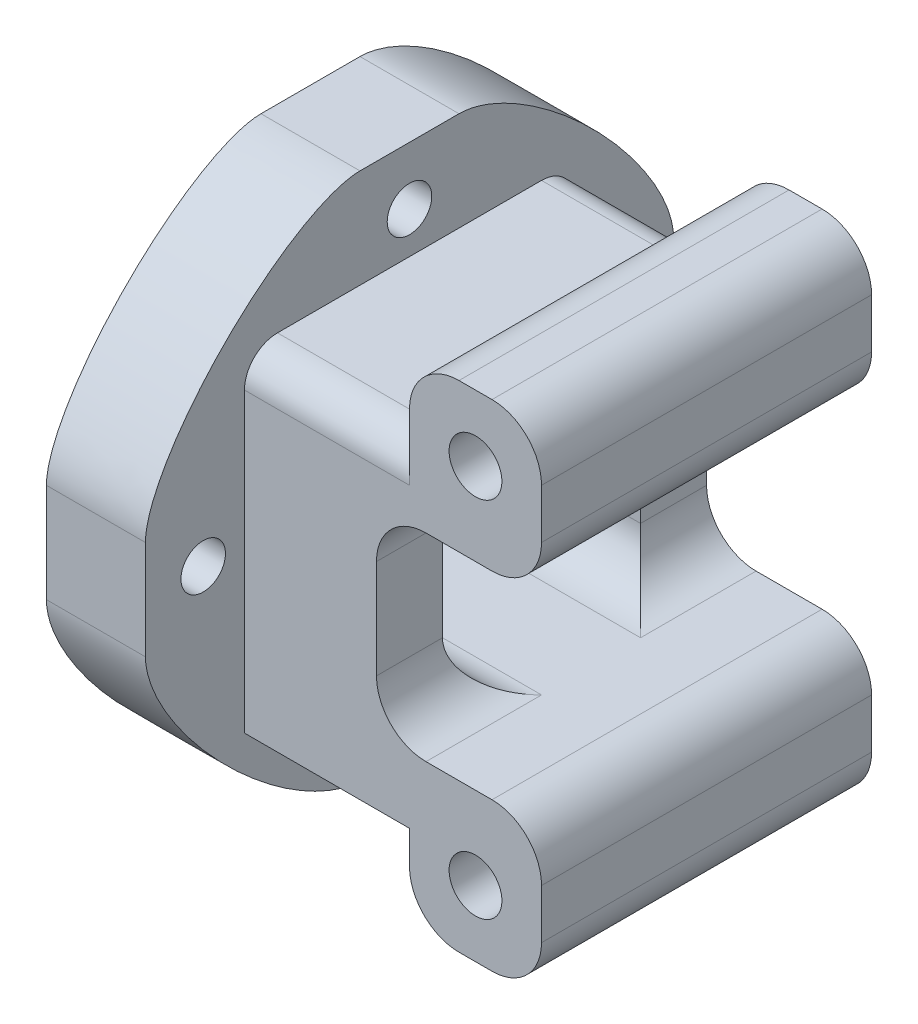
from build123d import *

# Parameters (mm, degrees)
SKETCH1_W           = 20
SKETCH1_H           = 20
BOSS_EXTRUDE1_DEPTH = 4
SKETCH2_R           = 3.65
CUT_EXTRUDE1_DEPTH  = 2.5
SKETCH3_R           = 2.25
CUT_EXTRUDE2_DEPTH  = 29.394541729
SKETCH4_W           = 12
SKETCH4_H           = 4
BOSS_EXTRUDE2_DEPTH = 10
SKETCH7_W           = 20
SKETCH7_H           = 4
BOSS_EXTRUDE3_DEPTH = 10
SKETCH8_W           = 8
SKETCH8_H           = 20
BOSS_EXTRUDE4_DEPTH = 5
SKETCH9_W           = 8
SKETCH9_H           = 20
BOSS_EXTRUDE5_DEPTH = 5
SKETCH10_R          = 1.6
CUT_EXTRUDE5_DEPTH  = 41.012498047
SKETCH11_W          = 32
SKETCH11_H          = 32
SKETCH11_W_2        = 20
SKETCH11_H_2        = 20
BOSS_EXTRUDE6_DEPTH = 6
FILLET6_R           = 3
SKETCH13_R          = 1.35
CUT_EXTRUDE7_DEPTH  = 6
FILLET7_R           = 3
FILLET13_R          = 2
FILLET14_SIZE       = 13


with BuildPart() as part:
    # Sketch1 → Boss-Extrude1 (new body)
    with BuildSketch(Plane(origin=(0, 0, 0), x_dir=(0, 0, -1), z_dir=(1, 0, 0))):
        with Locations((-10, -10)):
            Rectangle(SKETCH1_W, SKETCH1_H)
    extrude(amount=BOSS_EXTRUDE1_DEPTH)

    # Sketch2 → Cut-Extrude1 (cut)
    with BuildSketch(Plane(origin=(4, 0, 0), x_dir=(0, 0, -1), z_dir=(1, 0, 0))):
        with Locations((-10, -10)):
            Circle(SKETCH2_R)
    extrude(amount=-CUT_EXTRUDE1_DEPTH, mode=Mode.SUBTRACT)

    # Sketch3 → Cut-Extrude2 (cut, through all)
    with BuildSketch(Plane(origin=(1.5, 0, 0), x_dir=(0, 0, -1), z_dir=(1, 0, 0))):
        with Locations((-10, -10)):
            Circle(SKETCH3_R)
    extrude(amount=-CUT_EXTRUDE2_DEPTH, mode=Mode.SUBTRACT)

    # Sketch4 → Boss-Extrude2 (add)
    with BuildSketch(Plane(origin=(4, 0, 0), x_dir=(0, 0, -1), z_dir=(1, 0, 0))):
        Polygon((-20, 0), (-20, -20), (-16, -20), (-16, -16), (-16, -4), (-16, 0), align=None)
        with Locations((-10, -18)):
            Rectangle(SKETCH4_W, SKETCH4_H)
        Polygon((-4, -16), (-4, -20), (0, -20), (0, -4), (-4, -4), align=None)
        Polygon((0, 0), (-16, 0), (-16, -4), (-4, -4), (0, -4), align=None)
    extrude(amount=BOSS_EXTRUDE2_DEPTH)

    # Sketch7 → Boss-Extrude3 (add)
    with BuildSketch(Plane(origin=(14, 0, 0), x_dir=(0, 0, -1), z_dir=(1, 0, 0))):
        with Locations((-10, -18)):
            Rectangle(SKETCH7_W, SKETCH7_H)
        with Locations((-10, -2)):
            Rectangle(SKETCH7_W, SKETCH7_H)
    extrude(amount=BOSS_EXTRUDE3_DEPTH)

    # Sketch8 → Boss-Extrude4 (add)
    with BuildSketch(Plane(origin=(0, -20, 0), x_dir=(-1, 0, 0), z_dir=(0, -1, 0))):
        with Locations((-20, -10)):
            Rectangle(SKETCH8_W, SKETCH8_H)
    extrude(amount=BOSS_EXTRUDE4_DEPTH)

    # Sketch9 → Boss-Extrude5 (add)
    with BuildSketch(Plane(origin=(0, 0, 0), x_dir=(1, 0, 0), z_dir=(0, 1, 0))):
        with Locations((20, -10)):
            Rectangle(SKETCH9_W, SKETCH9_H)
    extrude(amount=BOSS_EXTRUDE5_DEPTH)

    # Sketch10 → Cut-Extrude5 (cut, through all)
    with BuildSketch(Plane(origin=(0, 0, 0), x_dir=(-1, 0, 0), z_dir=(0, 0, -1))):
        with Locations(Location((-20, 1, 0), (0, 0, 90))):
            Circle(SKETCH10_R)
        with Locations(Location((-20, -21, 0), (0, 0, 90))):
            Circle(SKETCH10_R)
    extrude(amount=-CUT_EXTRUDE5_DEPTH, mode=Mode.SUBTRACT)

    # Sketch11 → Boss-Extrude6 (add)
    with BuildSketch(Plane.ZY):
        with Locations((10, -10)):
            Rectangle(SKETCH11_W, SKETCH11_H)
        with Locations((10, -10)):
            Rectangle(SKETCH11_W_2, SKETCH11_H_2, mode=Mode.SUBTRACT)
    extrude(amount=-BOSS_EXTRUDE6_DEPTH)

    # Fillet6
    fillet6_edges = [part.edges().sort_by_distance(p)[0] for p in [
        (24, -16, 10),
        (24, -4, 10),
        (24, -25, 10),
        (16, -25, 10),
        (24, 5, 10),
        (16, 5, 10),
    ]]
    fillet(fillet6_edges, radius=FILLET6_R)

    # Sketch13 → Cut-Extrude7 (cut)
    with BuildSketch(Plane.ZY):
        with Locations((22.5, -10)):
            Circle(SKETCH13_R)
        with Locations((10, 2.5)):
            Circle(SKETCH13_R)
        with Locations((-2.5, -10)):
            Circle(SKETCH13_R)
        with Locations((10, -22.5)):
            Circle(SKETCH13_R)
    extrude(amount=-CUT_EXTRUDE7_DEPTH, mode=Mode.SUBTRACT)

    # Fillet7
    fillet7_edges = [part.edges().sort_by_distance(p)[0] for p in [
        (9, -4, 16),
        (9, -4, 4),
        (9, -16, 4),
        (9, -16, 16),
        (14, -16, 18),
        (14, -16, 2),
        (14, -4, 2),
        (14, -4, 18),
    ]]
    fillet(fillet7_edges, radius=FILLET7_R)

    # Fillet13
    fillet13_edges = [part.edges().sort_by_distance(p)[0] for p in [
        (11, 0, 20),
        (11, 0, 0),
    ]]
    fillet(fillet13_edges, radius=FILLET13_R)

    # Fillet14
    # a fillet whose section is not a circle: 13 mm, written as the material it takes off along each edge
    with BuildSketch(Plane(origin=(0, -26, -6), x_dir=(0, 1, 0), z_dir=(1, 0, 0)), Plane(origin=(0, -26, 26), x_dir=(0, 0, -1), z_dir=(1, 0, 0))) as fillet14_piece_1:
        with BuildLine():
            Bezier((FILLET14_SIZE, 0), (0, 0), (0, FILLET14_SIZE), weights=[1, 0.333333333, 1])
            Line((0, FILLET14_SIZE), (-FILLET14_SIZE * 0.02, FILLET14_SIZE))
            Line((-FILLET14_SIZE * 0.02, FILLET14_SIZE), (-FILLET14_SIZE * 0.02, -FILLET14_SIZE * 0.02))
            Line((-FILLET14_SIZE * 0.02, -FILLET14_SIZE * 0.02), (FILLET14_SIZE, -FILLET14_SIZE * 0.02))
            Line((FILLET14_SIZE, -FILLET14_SIZE * 0.02), (FILLET14_SIZE, 0))
        make_face()
    extrude(amount=6, mode=Mode.SUBTRACT)
    with BuildSketch(Plane(origin=(0, 6, -6), x_dir=(0, -1, 0), z_dir=(1, 0, 0)), Plane(origin=(0, 6, 26), x_dir=(0, 0, -1), z_dir=(1, 0, 0))) as fillet14_piece_2:
        with BuildLine():
            Bezier((FILLET14_SIZE, 0), (0, 0), (0, -FILLET14_SIZE), weights=[1, 0.333333333, 1])
            Line((0, -FILLET14_SIZE), (-FILLET14_SIZE * 0.02, -FILLET14_SIZE))
            Line((-FILLET14_SIZE * 0.02, -FILLET14_SIZE), (-FILLET14_SIZE * 0.02, FILLET14_SIZE * 0.02))
            Line((-FILLET14_SIZE * 0.02, FILLET14_SIZE * 0.02), (FILLET14_SIZE, FILLET14_SIZE * 0.02))
            Line((FILLET14_SIZE, FILLET14_SIZE * 0.02), (FILLET14_SIZE, 0))
        make_face()
    extrude(amount=6, mode=Mode.SUBTRACT)


solid = part.part
